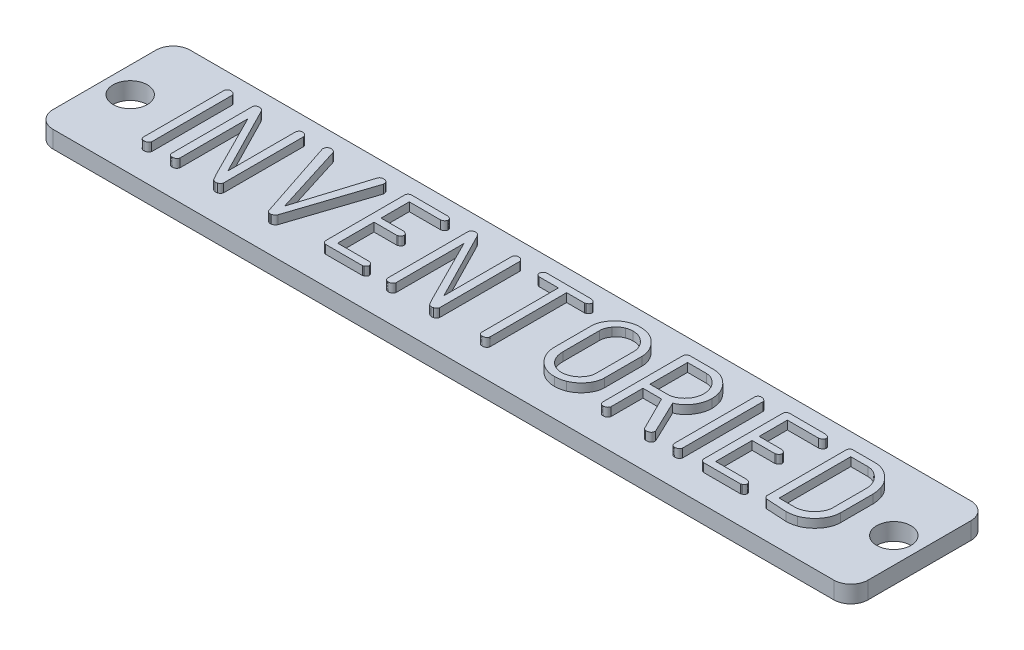
from build123d import *

# Parameters (mm, degrees)
BOSS_EXTRUDE1_DEPTH     = 2
BOSS_EXTRUDE2_DEPTH     = 1
CUT_EXTRUDE1_DEPTH      = 50.328003401
CUT_EXTRUDE1_DEPTH_BACK = 50.328003401
SKETCH1_4_R             = 2


# Read off the part's stored shape, not the designer's step: Boss-Extrude2
with BuildPart() as part:
    # Sketch1 → Boss-Extrude1 (new body)
    with BuildSketch(Plane(origin=(0, 0, 0), x_dir=(1, 0, 0), z_dir=(0, 1, 0))):
        with BuildLine():
            Line((-45.542106678, 13), (45.542106678, 13))
            ThreePointArc((45.542106678, 13), (46.956320241, 12.414213562), (47.542106678, 11))
            Line((47.542106678, 11), (47.542106678, -1))
            ThreePointArc((47.542106678, -1), (46.956320241, -2.414213562), (45.542106678, -3))
            Line((45.542106678, -3), (-45.542106678, -3))
            ThreePointArc((-45.542106678, -3), (-46.956320241, -2.414213562), (-47.542106678, -1))
            Line((-47.542106678, -1), (-47.542106678, 11))
            ThreePointArc((-47.542106678, 11), (-46.956320241, 12.414213562), (-45.542106678, 13))
        make_face()
    extrude(amount=-BOSS_EXTRUDE1_DEPTH)

    # Boss-Extrude2 outline → Boss-Extrude2 (add)
    # profile 1 of 11: a face of its own
    with BuildSketch(Plane(origin=(0, 0, 0), x_dir=(1, 0, 0), z_dir=(0, 1, 0))):
        with BuildLine():
            add(Edge.make_bspline(
                [(-38.161386986, 10.273972603), (-38.102609907, 10.2711418), (-37.989775214, 10.265707491), (-37.830800541, 10.223216376), (-37.69247229, 10.148937164), (-37.619829868, 10.078205715), (-37.583476027, 10.042808219)],
                knots=[0, 0, 0, 0, 0.27475157, 0.527442151, 0.763508807, 1, 1, 1, 1], degree=3))
            add(Edge.make_bspline(
                [(-38.493150685, 9.929366438), (-38.481282362, 9.971800618), (-38.458574036, 10.052992305), (-38.38566006, 10.1564348), (-38.285877994, 10.235772171), (-38.204035231, 10.260885863), (-38.161386986, 10.273972603)],
                knots=[0, 0, 0, 0, 0.259492963, 0.496502381, 0.737627502, 1, 1, 1, 1], degree=3))
            Line((-38.493150685, 9.929366438), (-38.493150685, 0.488013699))
            add(Edge.make_bspline(
                [(-38.075770548, 0.136986301), (-38.130183621, 0.140034548), (-38.23189097, 0.145732242), (-38.366410472, 0.216502274), (-38.459757011, 0.336338436), (-38.481478319, 0.434997394), (-38.493150685, 0.488013699)],
                knots=[0, 0, 0, 0, 0.268759312, 0.502357157, 0.732581963, 1, 1, 1, 1], degree=3))
            add(Edge.make_bspline(
                [(-37.534246575, 0.505136986), (-37.554528221, 0.44933089), (-37.59361884, 0.341770841), (-37.718909388, 0.218629383), (-37.885878051, 0.147877363), (-38.009380125, 0.140794046), (-38.075770548, 0.136986301)],
                knots=[0, 0, 0, 0, 0.24872534, 0.479390456, 0.720138401, 1, 1, 1, 1], degree=3))
            Line((-37.534246575, 0.505136986), (-37.534246575, 9.918664384))
            Line((-37.534246575, 9.918664384), (-37.583476027, 10.042808219))
        make_face()
    # profile 2 of 11: a face of its own
    with BuildSketch(Plane(origin=(0, 0, 0), x_dir=(1, 0, 0), z_dir=(0, 1, 0))):
        with BuildLine():
            add(Edge.make_bspline(
                [(-34.400684932, 10.171232877), (-34.3823995, 10.153804606), (-34.339800633, 10.113202632), (-34.278836533, 10.031580613), (-34.208692647, 9.925201092), (-34.162551193, 9.843377172), (-34.137414384, 9.79880137)],
                knots=[0, 0, 0, 0, 0.165236548, 0.384945242, 0.664932222, 1, 1, 1, 1], degree=3))
            add(Edge.make_bspline(
                [(-34.762414384, 10.273972603), (-34.727341018, 10.272895533), (-34.660181187, 10.270833119), (-34.564313224, 10.250821306), (-34.476898287, 10.219462501), (-34.425879278, 10.187176459), (-34.400684932, 10.171232877)],
                knots=[0, 0, 0, 0, 0.275177783, 0.526921011, 0.766382832, 1, 1, 1, 1], degree=3))
            add(Edge.make_bspline(
                [(-34.905821918, 10.237585616), (-34.891287252, 10.248210886), (-34.849579827, 10.278700243), (-34.796800552, 10.275837624), (-34.762414384, 10.273972603)],
                knots=[0, 0, 0, 0, 0.348491089, 1, 1, 1, 1], degree=3))
            add(Edge.make_bspline(
                [(-35.205479452, 9.914383562), (-35.193582818, 9.959503662), (-35.171657311, 10.042660042), (-35.106581551, 10.147307126), (-35.014121801, 10.215887045), (-34.942514672, 10.230233989), (-34.905821918, 10.237585616)],
                knots=[0, 0, 0, 0, 0.294254159, 0.542310647, 0.76547191, 1, 1, 1, 1], degree=3))
            Line((-35.205479452, 9.914383562), (-35.205479452, 0.488013699))
            add(Edge.make_bspline(
                [(-34.788099315, 0.136986301), (-34.842512389, 0.140034548), (-34.944219737, 0.145732242), (-35.078739239, 0.216502274), (-35.172085778, 0.336338436), (-35.193807086, 0.434997394), (-35.205479452, 0.488013699)],
                knots=[0, 0, 0, 0, 0.268759312, 0.502357157, 0.732581963, 1, 1, 1, 1], degree=3))
            add(Edge.make_bspline(
                [(-34.246575342, 0.505136986), (-34.266856988, 0.44933089), (-34.305947607, 0.341770841), (-34.431238156, 0.218629383), (-34.598206818, 0.147877363), (-34.721708892, 0.140794046), (-34.788099315, 0.136986301)],
                knots=[0, 0, 0, 0, 0.24872534, 0.479390456, 0.720138401, 1, 1, 1, 1], degree=3))
            Line((-34.246575342, 0.505136986), (-34.246575342, 8.435359589))
            Line((-34.246575342, 8.435359589), (-30.520119863, 1.044520548))
            Line((-30.520119863, 1.044520548), (-30.132705479, 0.353167808))
            Line((-30.132705479, 0.353167808), (-30.072773973, 0.265410959))
            add(Edge.make_bspline(
                [(-29.745291096, 0.136986301), (-29.773984311, 0.138808669), (-29.831600646, 0.142468005), (-29.916690999, 0.167098084), (-29.998560272, 0.207943798), (-30.047673968, 0.245974844), (-30.072773973, 0.265410959)],
                knots=[0, 0, 0, 0, 0.239834372, 0.481590406, 0.735062032, 1, 1, 1, 1], degree=3))
            add(Edge.make_bspline(
                [(-29.548373288, 0.171232877), (-29.550022963, 0.165707835), (-29.555511031, 0.147327371), (-29.602357051, 0.145695886), (-29.661585021, 0.136425486), (-29.714032227, 0.136776873), (-29.745291096, 0.136986301)],
                knots=[0, 0, 0, 0, 0.078108728, 0.259848672, 0.558865087, 1, 1, 1, 1], degree=3))
            add(Edge.make_bspline(
                [(-29.178082192, 0.517979452), (-29.191051229, 0.474567522), (-29.216340142, 0.389916635), (-29.300512558, 0.286003577), (-29.413080199, 0.209273568), (-29.501614892, 0.18438005), (-29.548373288, 0.171232877)],
                knots=[0, 0, 0, 0, 0.250944294, 0.489327633, 0.730295328, 1, 1, 1, 1], degree=3))
            Line((-29.178082192, 0.517979452), (-29.178082192, 9.882277397))
            add(Edge.make_bspline(
                [(-29.364297945, 10.17765411), (-29.338671014, 10.149619303), (-29.291632892, 10.098161537), (-29.235648145, 10.019819813), (-29.193454387, 9.950724769), (-29.182812782, 9.903341171), (-29.178082192, 9.882277397)],
                knots=[0, 0, 0, 0, 0.321675196, 0.590433445, 0.817932412, 1, 1, 1, 1], degree=3))
            add(Edge.make_bspline(
                [(-29.73244863, 10.273972603), (-29.69314481, 10.272640905), (-29.619117943, 10.270132715), (-29.517125805, 10.254679401), (-29.431005078, 10.225149796), (-29.385832191, 10.192986559), (-29.364297945, 10.17765411)],
                knots=[0, 0, 0, 0, 0.304096482, 0.572751191, 0.796327371, 1, 1, 1, 1], degree=3))
            add(Edge.make_bspline(
                [(-30.136986301, 9.935787671), (-30.116732965, 9.986332295), (-30.079091474, 10.080271138), (-29.98723481, 10.194905506), (-29.865756821, 10.262080611), (-29.777454674, 10.26995776), (-29.73244863, 10.273972603)],
                knots=[0, 0, 0, 0, 0.287476847, 0.534285164, 0.76263338, 1, 1, 1, 1], degree=3))
            Line((-30.136986301, 9.935787671), (-30.136986301, 1.982020548))
            Line((-30.136986301, 1.982020548), (-34.137414384, 9.79880137))
        make_face()
    # profile 3 of 11: a face of its own
    with BuildSketch(Plane(origin=(0, 0, 0), x_dir=(1, 0, 0), z_dir=(0, 1, 0))):
        with BuildLine():
            add(Edge.make_bspline(
                [(-26.224315068, 10.248287671), (-26.191783343, 10.241044875), (-26.12645103, 10.226499425), (-26.033806204, 10.179544252), (-25.949344866, 10.109305345), (-25.90221718, 10.050184854), (-25.877568493, 10.019263699)],
                knots=[0, 0, 0, 0, 0.233686117, 0.469303557, 0.722435545, 1, 1, 1, 1], degree=3))
            add(Edge.make_bspline(
                [(-26.391267123, 10.273972603), (-26.356802217, 10.271704311), (-26.30033717, 10.267988091), (-26.245630215, 10.253811293), (-26.224315068, 10.248287671)],
                knots=[0, 0, 0, 0, 0.61037594, 1, 1, 1, 1], degree=3))
            add(Edge.make_bspline(
                [(-26.746575342, 10.113441781), (-26.715166222, 10.138060591), (-26.656309626, 10.184193031), (-26.563281021, 10.233118813), (-26.476257472, 10.266598782), (-26.418632936, 10.271598326), (-26.391267123, 10.273972603)],
                knots=[0, 0, 0, 0, 0.301191759, 0.564394074, 0.793131351, 1, 1, 1, 1], degree=3))
            add(Edge.make_bspline(
                [(-26.849315068, 9.73244863), (-26.845934639, 9.803092849), (-26.839488505, 9.937804176), (-26.776521637, 10.056833058), (-26.746575342, 10.113441781)],
                knots=[0, 0, 0, 0, 0.524411873, 1, 1, 1, 1], degree=3))
            Line((-26.849315068, 9.73244863), (-23.741438356, 0.351027397))
            Line((-23.741438356, 0.351027397), (-23.621575342, 0.231164384))
            add(Edge.make_bspline(
                [(-23.356164384, 0.136986301), (-23.408731254, 0.139685655), (-23.506977908, 0.144730705), (-23.585204081, 0.203731816), (-23.621575342, 0.231164384)],
                knots=[0, 0, 0, 0, 0.535049981, 1, 1, 1, 1], degree=3))
            add(Edge.make_bspline(
                [(-23.23630137, 0.143407534), (-23.263414693, 0.142007408), (-23.303373194, 0.13994396), (-23.343322243, 0.13770579), (-23.356164384, 0.136986301)],
                knots=[0, 0, 0, 0, 0.67853703, 1, 1, 1, 1], degree=3))
            add(Edge.make_bspline(
                [(-23.193493151, 0.15625), (-23.199277098, 0.155823407), (-23.214387379, 0.154708954), (-23.227937806, 0.147720767), (-23.23630137, 0.143407534)],
                knots=[0, 0, 0, 0, 0.382782219, 1, 1, 1, 1], degree=3))
            add(Edge.make_bspline(
                [(-22.786815068, 0.492294521), (-22.796671701, 0.459640636), (-22.818068539, 0.38875539), (-22.907833352, 0.299772336), (-23.034034171, 0.219183371), (-23.13684529, 0.178607103), (-23.193493151, 0.15625)],
                knots=[0, 0, 0, 0, 0.183665808, 0.398702824, 0.668691492, 1, 1, 1, 1], degree=3))
            Line((-22.786815068, 0.492294521), (-19.726027397, 9.749571918))
            add(Edge.make_bspline(
                [(-19.781678082, 10.038527397), (-19.764918448, 9.992635919), (-19.73084486, 9.899335117), (-19.72765054, 9.800031484), (-19.726027397, 9.749571918)],
                knots=[0, 0, 0, 0, 0.491865853, 1, 1, 1, 1], degree=3))
            add(Edge.make_bspline(
                [(-20.306078767, 10.273972603), (-20.245152084, 10.271381061), (-20.132905263, 10.266606596), (-19.979314302, 10.225546632), (-19.857619135, 10.148672329), (-19.806679644, 10.074789672), (-19.781678082, 10.038527397)],
                knots=[0, 0, 0, 0, 0.30258632, 0.557462689, 0.782798694, 1, 1, 1, 1], degree=3))
            add(Edge.make_bspline(
                [(-20.695633562, 10.040667808), (-20.670942448, 10.076426298), (-20.623918057, 10.14452858), (-20.528761094, 10.219448439), (-20.42128622, 10.265658021), (-20.34506642, 10.271158844), (-20.306078767, 10.273972603)],
                knots=[0, 0, 0, 0, 0.273150591, 0.520217122, 0.754583347, 1, 1, 1, 1], degree=3))
            Line((-20.695633562, 10.040667808), (-23.279109589, 1.746575342))
            Line((-23.279109589, 1.746575342), (-25.877568493, 10.019263699))
        make_face()
    # profile 4 of 11: a face of its own
    with BuildSketch(Plane(origin=(0, 0, 0), x_dir=(1, 0, 0), z_dir=(0, 1, 0))):
        with BuildLine():
            add(Edge.make_bspline(
                [(-17.397260274, 9.922945205), (-17.384782391, 9.963606955), (-17.361070807, 10.040876033), (-17.298404048, 10.142035151), (-17.208064915, 10.214625013), (-17.136447161, 10.238296483), (-17.099743151, 10.250428082)],
                knots=[0, 0, 0, 0, 0.272676902, 0.518164929, 0.753060126, 1, 1, 1, 1], degree=3))
            Line((-17.397260274, 9.922945205), (-17.397260274, 0.614297945))
            add(Edge.make_bspline(
                [(-17.059075342, 0.273972603), (-17.101465316, 0.286632065), (-17.182759789, 0.310910077), (-17.286503053, 0.3847105), (-17.360829759, 0.489002889), (-17.384715257, 0.571152011), (-17.397260274, 0.614297945)],
                knots=[0, 0, 0, 0, 0.259685621, 0.498018845, 0.73635207, 1, 1, 1, 1], degree=3))
            Line((-17.059075342, 0.273972603), (-12.735445205, 0.273972603))
            Line((-12.735445205, 0.273972603), (-12.585616438, 0.329623288))
            add(Edge.make_bspline(
                [(-12.315924658, 0.678510274), (-12.31993762, 0.650156894), (-12.328689146, 0.588323445), (-12.38334867, 0.498200659), (-12.472276966, 0.411427331), (-12.545534789, 0.358552671), (-12.585616438, 0.329623288)],
                knots=[0, 0, 0, 0, 0.186643541, 0.407034852, 0.675570191, 1, 1, 1, 1], degree=3))
            add(Edge.make_bspline(
                [(-12.360873288, 0.723458904), (-12.352385044, 0.720622202), (-12.330642208, 0.713355923), (-12.321498642, 0.691707383), (-12.315924658, 0.678510274)],
                knots=[0, 0, 0, 0, 0.390392645, 1, 1, 1, 1], degree=3))
            add(Edge.make_bspline(
                [(-12.369434932, 0.815496575), (-12.36694934, 0.798403905), (-12.362508481, 0.767865447), (-12.361373159, 0.737033787), (-12.360873288, 0.723458904)],
                knots=[0, 0, 0, 0, 0.559709661, 1, 1, 1, 1], degree=3))
            add(Edge.make_bspline(
                [(-12.793236301, 1.095890411), (-12.73472566, 1.08144198), (-12.629907435, 1.055558501), (-12.497573146, 0.995039531), (-12.401596415, 0.916869115), (-12.379682076, 0.84779543), (-12.369434932, 0.815496575)],
                knots=[0, 0, 0, 0, 0.336090886, 0.602086212, 0.813935517, 1, 1, 1, 1], degree=3))
            Line((-12.793236301, 1.095890411), (-16.438356164, 1.095890411))
            Line((-16.438356164, 1.095890411), (-16.438356164, 5.342465753))
            Line((-16.438356164, 5.342465753), (-13.773544521, 5.342465753))
            Line((-13.773544521, 5.342465753), (-13.636558219, 5.391695205))
            add(Edge.make_bspline(
                [(-13.345462329, 5.798373288), (-13.348167103, 5.756220808), (-13.353516409, 5.67285469), (-13.415424126, 5.559498877), (-13.509155268, 5.460697715), (-13.592057039, 5.415797419), (-13.636558219, 5.391695205)],
                knots=[0, 0, 0, 0, 0.236932624, 0.468588157, 0.714741263, 1, 1, 1, 1], degree=3))
            add(Edge.make_bspline(
                [(-13.797089041, 6.164383562), (-13.735337724, 6.14876568), (-13.622829577, 6.120310596), (-13.481368688, 6.039946322), (-13.380207202, 5.932095408), (-13.357031092, 5.842897829), (-13.345462329, 5.798373288)],
                knots=[0, 0, 0, 0, 0.307251644, 0.559798792, 0.780265824, 1, 1, 1, 1], degree=3))
            Line((-13.797089041, 6.164383562), (-16.438356164, 6.164383562))
            Line((-16.438356164, 6.164383562), (-16.438356164, 9.452054795))
            Line((-16.438356164, 9.452054795), (-12.782534247, 9.452054795))
            add(Edge.make_bspline(
                [(-12.315924658, 9.850171233), (-12.322458116, 9.821831887), (-12.339639122, 9.747308036), (-12.400912691, 9.659289362), (-12.474395173, 9.579257672), (-12.558962821, 9.526664591), (-12.662517783, 9.4811462), (-12.740728272, 9.462188359), (-12.782534247, 9.452054795)],
                knots=[0, 0, 0, 0, 0.132894215, 0.34947132, 0.481675803, 0.630852073, 0.802678783, 1, 1, 1, 1], degree=3))
            add(Edge.make_bspline(
                [(-12.782534247, 10.261130137), (-12.746022262, 10.25390885), (-12.677196703, 10.240296631), (-12.580546827, 10.211234672), (-12.499828007, 10.170062466), (-12.430940598, 10.124102212), (-12.380947951, 10.066037396), (-12.342916015, 10.001983549), (-12.318377868, 9.928946818), (-12.316752702, 9.876760753), (-12.315924658, 9.850171233)],
                knots=[0, 0, 0, 0, 0.163024703, 0.307303648, 0.440057753, 0.558837742, 0.667306054, 0.77234457, 0.884006416, 1, 1, 1, 1], degree=3))
            Line((-12.782534247, 10.261130137), (-17.05265411, 10.273972603))
            Line((-17.05265411, 10.273972603), (-17.099743151, 10.250428082))
        make_face()
    # profile 5 of 11: a face of its own
    with BuildSketch(Plane(origin=(0, 0, 0), x_dir=(1, 0, 0), z_dir=(0, 1, 0))):
        with BuildLine():
            add(Edge.make_bspline(
                [(-9.195205479, 10.171232877), (-9.176920048, 10.153804606), (-9.134321181, 10.113202632), (-9.073357081, 10.031580613), (-9.003213194, 9.925201092), (-8.957071741, 9.843377172), (-8.931934932, 9.79880137)],
                knots=[0, 0, 0, 0, 0.165236548, 0.384945242, 0.664932222, 1, 1, 1, 1], degree=3))
            add(Edge.make_bspline(
                [(-9.556934932, 10.273972603), (-9.521861566, 10.272895533), (-9.454701735, 10.270833119), (-9.358833772, 10.250821306), (-9.271418835, 10.219462501), (-9.220399826, 10.187176459), (-9.195205479, 10.171232877)],
                knots=[0, 0, 0, 0, 0.275177783, 0.526921011, 0.766382832, 1, 1, 1, 1], degree=3))
            add(Edge.make_bspline(
                [(-9.700342466, 10.237585616), (-9.6858078, 10.248210886), (-9.644100375, 10.278700243), (-9.5913211, 10.275837624), (-9.556934932, 10.273972603)],
                knots=[0, 0, 0, 0, 0.348491089, 1, 1, 1, 1], degree=3))
            add(Edge.make_bspline(
                [(-10, 9.914383562), (-9.988103366, 9.959503662), (-9.966177859, 10.042660042), (-9.901102099, 10.147307126), (-9.808642349, 10.215887045), (-9.73703522, 10.230233989), (-9.700342466, 10.237585616)],
                knots=[0, 0, 0, 0, 0.294254159, 0.542310647, 0.76547191, 1, 1, 1, 1], degree=3))
            Line((-10, 9.914383562), (-10, 0.488013699))
            add(Edge.make_bspline(
                [(-9.582619863, 0.136986301), (-9.637032937, 0.140034548), (-9.738740285, 0.145732242), (-9.873259787, 0.216502274), (-9.966606326, 0.336338436), (-9.988327634, 0.434997394), (-10, 0.488013699)],
                knots=[0, 0, 0, 0, 0.268759312, 0.502357157, 0.732581963, 1, 1, 1, 1], degree=3))
            add(Edge.make_bspline(
                [(-9.04109589, 0.505136986), (-9.061377536, 0.44933089), (-9.100468155, 0.341770841), (-9.225758704, 0.218629383), (-9.392727366, 0.147877363), (-9.51622944, 0.140794046), (-9.582619863, 0.136986301)],
                knots=[0, 0, 0, 0, 0.24872534, 0.479390456, 0.720138401, 1, 1, 1, 1], degree=3))
            Line((-9.04109589, 0.505136986), (-9.04109589, 8.435359589))
            Line((-9.04109589, 8.435359589), (-5.314640411, 1.044520548))
            Line((-5.314640411, 1.044520548), (-4.927226027, 0.353167808))
            Line((-4.927226027, 0.353167808), (-4.867294521, 0.265410959))
            add(Edge.make_bspline(
                [(-4.539811644, 0.136986301), (-4.568504859, 0.138808669), (-4.626121194, 0.142468005), (-4.711211547, 0.167098084), (-4.79308082, 0.207943798), (-4.842194516, 0.245974844), (-4.867294521, 0.265410959)],
                knots=[0, 0, 0, 0, 0.239834372, 0.481590406, 0.735062032, 1, 1, 1, 1], degree=3))
            add(Edge.make_bspline(
                [(-4.342893836, 0.171232877), (-4.344543511, 0.165707835), (-4.350031579, 0.147327371), (-4.396877599, 0.145695886), (-4.456105569, 0.136425486), (-4.508552775, 0.136776873), (-4.539811644, 0.136986301)],
                knots=[0, 0, 0, 0, 0.078108728, 0.259848672, 0.558865087, 1, 1, 1, 1], degree=3))
            add(Edge.make_bspline(
                [(-3.97260274, 0.517979452), (-3.985571777, 0.474567522), (-4.01086069, 0.389916635), (-4.095033106, 0.286003577), (-4.207600747, 0.209273568), (-4.29613544, 0.18438005), (-4.342893836, 0.171232877)],
                knots=[0, 0, 0, 0, 0.250944294, 0.489327633, 0.730295328, 1, 1, 1, 1], degree=3))
            Line((-3.97260274, 0.517979452), (-3.97260274, 9.882277397))
            add(Edge.make_bspline(
                [(-4.158818493, 10.17765411), (-4.133191562, 10.149619303), (-4.08615344, 10.098161537), (-4.030168693, 10.019819813), (-3.987974935, 9.950724769), (-3.97733333, 9.903341171), (-3.97260274, 9.882277397)],
                knots=[0, 0, 0, 0, 0.321675196, 0.590433445, 0.817932412, 1, 1, 1, 1], degree=3))
            add(Edge.make_bspline(
                [(-4.526969178, 10.273972603), (-4.487665358, 10.272640905), (-4.413638491, 10.270132715), (-4.311646353, 10.254679401), (-4.225525626, 10.225149796), (-4.180352739, 10.192986559), (-4.158818493, 10.17765411)],
                knots=[0, 0, 0, 0, 0.304096482, 0.572751191, 0.796327371, 1, 1, 1, 1], degree=3))
            add(Edge.make_bspline(
                [(-4.931506849, 9.935787671), (-4.911253513, 9.986332295), (-4.873612022, 10.080271138), (-4.781755358, 10.194905506), (-4.660277369, 10.262080611), (-4.571975222, 10.26995776), (-4.526969178, 10.273972603)],
                knots=[0, 0, 0, 0, 0.287476847, 0.534285164, 0.76263338, 1, 1, 1, 1], degree=3))
            Line((-4.931506849, 9.935787671), (-4.931506849, 1.982020548))
            Line((-4.931506849, 1.982020548), (-8.931934932, 9.79880137))
        make_face()
    # profile 6 of 11: a face of its own
    with BuildSketch(Plane(origin=(0, 0, 0), x_dir=(1, 0, 0), z_dir=(0, 1, 0))):
        with BuildLine():
            add(Edge.make_bspline(
                [(-1.42765411, 10.220462329), (-1.405515047, 10.228251095), (-1.356119646, 10.245628942), (-1.307045064, 10.263893974), (-1.279965753, 10.273972603)],
                knots=[0, 0, 0, 0, 0.448200883, 1, 1, 1, 1], degree=3))
            add(Edge.make_bspline(
                [(-1.643835616, 9.758133562), (-1.641821033, 9.806978313), (-1.637977208, 9.900174087), (-1.596534828, 10.030040923), (-1.526260461, 10.139991155), (-1.46069715, 10.193496396), (-1.42765411, 10.220462329)],
                knots=[0, 0, 0, 0, 0.274997332, 0.524694837, 0.760452496, 1, 1, 1, 1], degree=3))
            add(Edge.make_bspline(
                [(-1.282106164, 9.452054795), (-1.32434329, 9.462688927), (-1.405948578, 9.483234867), (-1.512326776, 9.550110354), (-1.59520855, 9.643108883), (-1.627341543, 9.719117728), (-1.643835616, 9.758133562)],
                knots=[0, 0, 0, 0, 0.261379594, 0.505004944, 0.745915827, 1, 1, 1, 1], degree=3))
            Line((-1.282106164, 9.452054795), (0.95890411, 9.452054795))
            Line((0.95890411, 9.452054795), (0.95890411, 0.488013699))
            add(Edge.make_bspline(
                [(1.369863014, 0.136986301), (1.315279653, 0.13971783), (1.21452144, 0.144760098), (1.083066286, 0.218042125), (0.989746921, 0.33588636), (0.96967249, 0.43490035), (0.95890411, 0.488013699)],
                knots=[0, 0, 0, 0, 0.270723937, 0.499743136, 0.731650881, 1, 1, 1, 1], degree=3))
            add(Edge.make_bspline(
                [(1.917808219, 0.522260274), (1.911695752, 0.492030779), (1.899876122, 0.433576241), (1.865822724, 0.35242093), (1.815314028, 0.28566734), (1.752890272, 0.228950863), (1.675450766, 0.187619908), (1.58519213, 0.15679616), (1.481715731, 0.140876576), (1.408436074, 0.138327885), (1.369863014, 0.136986301)],
                knots=[0, 0, 0, 0, 0.124465859, 0.240678661, 0.351959507, 0.460173341, 0.578897804, 0.703796937, 0.844084166, 1, 1, 1, 1], degree=3))
            Line((1.917808219, 0.522260274), (1.917808219, 9.452054795))
            Line((1.917808219, 9.452054795), (4.013270548, 9.452054795))
            Line((4.013270548, 9.452054795), (4.143835616, 9.497003425))
            add(Edge.make_bspline(
                [(4.462756849, 9.903681507), (4.459335891, 9.862869325), (4.452458533, 9.780822156), (4.384520338, 9.66829059), (4.2805155, 9.57057204), (4.19165244, 9.522741064), (4.143835616, 9.497003425)],
                knots=[0, 0, 0, 0, 0.222516328, 0.447337873, 0.702614928, 1, 1, 1, 1], degree=3))
            add(Edge.make_bspline(
                [(3.99614726, 10.261130137), (4.056986234, 10.245881945), (4.169405271, 10.217706139), (4.313526058, 10.141272413), (4.418318661, 10.035326683), (4.447967477, 9.947494039), (4.462756849, 9.903681507)],
                knots=[0, 0, 0, 0, 0.301790485, 0.557652335, 0.779348881, 1, 1, 1, 1], degree=3))
            Line((3.99614726, 10.261130137), (-1.279965753, 10.273972603))
        make_face()
    # profile 7 of 11: a face of its own
    with BuildSketch(Plane(origin=(0, 0, 0), x_dir=(1, 0, 0), z_dir=(0, 1, 0))):
        with BuildLine():
            add(Edge.make_bspline(
                [(11.716609589, 9.514126712), (11.797923745, 9.435579818), (11.956472837, 9.282426425), (12.165681355, 9.034807226), (12.340624736, 8.779150558), (12.49016066, 8.519099088), (12.60051087, 8.248534843), (12.680164005, 7.971562364), (12.732321047, 7.688181674), (12.737250421, 7.495944915), (12.739726027, 7.399400685)],
                knots=[0, 0, 0, 0, 0.140061782, 0.273097201, 0.40088926, 0.523625025, 0.644159001, 0.761979947, 0.880462701, 1, 1, 1, 1], degree=3))
            add(Edge.make_bspline(
                [(9.651113014, 10.273972603), (9.752507363, 10.271192685), (9.951594358, 10.26573434), (10.244158323, 10.2320435), (10.52338097, 10.171505128), (10.789621575, 10.088644828), (11.042258987, 9.980089858), (11.282176722, 9.849929827), (11.509186897, 9.695248166), (11.647132534, 9.574794063), (11.716609589, 9.514126712)],
                knots=[0, 0, 0, 0, 0.134933536, 0.264940918, 0.391191814, 0.514601435, 0.6353979, 0.756477576, 0.877348635, 1, 1, 1, 1], degree=3))
            add(Edge.make_bspline(
                [(8.540239726, 10.055650685), (8.629511826, 10.089710349), (8.807465609, 10.157604419), (9.084892559, 10.224350536), (9.366511386, 10.267183325), (9.556063853, 10.27170517), (9.651113014, 10.273972603)],
                knots=[0, 0, 0, 0, 0.251394257, 0.501125872, 0.749844632, 1, 1, 1, 1], degree=3))
            add(Edge.make_bspline(
                [(6.712328767, 7.497859589), (6.714134098, 7.564988713), (6.717717325, 7.698226811), (6.741645447, 7.896679311), (6.782583927, 8.092110834), (6.840058487, 8.284966053), (6.916484556, 8.47380981), (7.005495257, 8.660762964), (7.114141496, 8.842759813), (7.275420733, 9.081048068), (7.504250081, 9.357132408), (7.818737492, 9.641884802), (8.161608428, 9.882736625), (8.414044923, 9.998019803), (8.540239726, 10.055650685)],
                knots=[0, 0, 0, 0, 0.060601714, 0.120282475, 0.180161033, 0.240683965, 0.301684861, 0.363911284, 0.427431067, 0.492817583, 0.623615994, 0.749916976, 0.874981714, 1, 1, 1, 1], degree=3))
            Line((6.712328767, 7.497859589), (6.712328767, 3.328339041))
            add(Edge.make_bspline(
                [(7.703339041, 1.031678082), (7.623803043, 1.10850298), (7.467183356, 1.259784058), (7.26552822, 1.512571763), (7.095033583, 1.779663618), (6.955921605, 2.061244107), (6.844525706, 2.356894269), (6.769457947, 2.668271926), (6.719828683, 2.993555784), (6.714858386, 3.215421219), (6.712328767, 3.328339041)],
                knots=[0, 0, 0, 0, 0.128561489, 0.253159082, 0.37521953, 0.496626056, 0.617987158, 0.742019252, 0.868701386, 1, 1, 1, 1], degree=3))
            add(Edge.make_bspline(
                [(9.678938356, 0.273972603), (9.583952455, 0.276718296), (9.397641644, 0.282103857), (9.12294594, 0.316368451), (8.859245097, 0.376433365), (8.606076687, 0.460794665), (8.361890336, 0.565054671), (8.130545138, 0.697283545), (7.908228815, 0.851079448), (7.772127498, 0.971044987), (7.703339041, 1.031678082)],
                knots=[0, 0, 0, 0, 0.131444636, 0.257823069, 0.38236792, 0.505067676, 0.626670185, 0.74913138, 0.873205746, 1, 1, 1, 1], degree=3))
            add(Edge.make_bspline(
                [(10.839041096, 0.49015411), (10.749744824, 0.456842787), (10.568921664, 0.389388027), (10.283690799, 0.322932109), (9.985604208, 0.280338558), (9.782545855, 0.27612335), (9.678938356, 0.273972603)],
                knots=[0, 0, 0, 0, 0.240608794, 0.487227982, 0.738365719, 1, 1, 1, 1], degree=3))
            add(Edge.make_bspline(
                [(12.739726027, 3.050085616), (12.733733746, 2.922425257), (12.721671564, 2.66545093), (12.615933062, 2.285724106), (12.452519589, 1.912109927), (12.222609372, 1.554133471), (11.943355924, 1.220204129), (11.616293048, 0.926452435), (11.248376683, 0.676033242), (10.976671884, 0.552652197), (10.839041096, 0.49015411)],
                knots=[0, 0, 0, 0, 0.113452148, 0.228373862, 0.348384749, 0.475424725, 0.60569876, 0.734765808, 0.865646869, 1, 1, 1, 1], degree=3))
            Line((12.739726027, 3.050085616), (12.739726027, 7.399400685))
        make_face()
        with BuildLine():
            add(Edge.make_bspline(
                [(11.780821918, 7.474315068), (11.777178823, 7.545211018), (11.769664707, 7.691438445), (11.716818849, 7.914402222), (11.633017618, 8.147218522), (11.554368774, 8.299916201), (11.513270548, 8.379708904)],
                knots=[0, 0, 0, 0, 0.223016892, 0.459986593, 0.717814119, 1, 1, 1, 1], degree=3))
            Line((11.780821918, 7.474315068), (11.780821918, 3.017979452))
            add(Edge.make_bspline(
                [(10.445205479, 1.239297945), (10.535752732, 1.278026228), (10.716515225, 1.355340788), (10.964435125, 1.51970613), (11.191063942, 1.719152215), (11.393904446, 1.94949762), (11.563781263, 2.201320673), (11.688027637, 2.466769321), (11.768238371, 2.739339789), (11.776641423, 2.925410028), (11.780821918, 3.017979452)],
                knots=[0, 0, 0, 0, 0.125379626, 0.250299518, 0.377319107, 0.509474921, 0.640697204, 0.763218267, 0.882201749, 1, 1, 1, 1], degree=3))
            add(Edge.make_bspline(
                [(9.678938356, 1.095890411), (9.743260165, 1.097359801), (9.872507239, 1.100312367), (10.06504765, 1.129998007), (10.257181992, 1.174279606), (10.382044805, 1.217457045), (10.445205479, 1.239297945)],
                knots=[0, 0, 0, 0, 0.246095694, 0.494500214, 0.744297708, 1, 1, 1, 1], degree=3))
            add(Edge.make_bspline(
                [(8.418236301, 1.556078767), (8.463300091, 1.519598167), (8.5528397, 1.447112948), (8.696346602, 1.353656301), (8.845323089, 1.272507642), (9.001830622, 1.209766672), (9.162422012, 1.157372894), (9.329403552, 1.120834558), (9.502122432, 1.09909554), (9.619657287, 1.096964994), (9.678938356, 1.095890411)],
                knots=[0, 0, 0, 0, 0.126729323, 0.251805143, 0.373975833, 0.497129106, 0.620005273, 0.743049757, 0.870401974, 1, 1, 1, 1], degree=3))
            add(Edge.make_bspline(
                [(7.671232877, 3.300513699), (7.672747576, 3.211174835), (7.675705761, 3.036697445), (7.714621713, 2.78255622), (7.770727962, 2.54174833), (7.853152541, 2.31501992), (7.957933476, 2.102030294), (8.087514772, 1.90394449), (8.240425083, 1.719807585), (8.358420964, 1.611156813), (8.418236301, 1.556078767)],
                knots=[0, 0, 0, 0, 0.136556167, 0.266692039, 0.392450928, 0.514341456, 0.634919896, 0.754814547, 0.875708792, 1, 1, 1, 1], degree=3))
            Line((7.671232877, 3.300513699), (7.671232877, 7.529965753))
            add(Edge.make_bspline(
                [(8.037243151, 8.600171233), (7.980685173, 8.519155427), (7.869665139, 8.360126092), (7.75699571, 8.093697634), (7.684684744, 7.816346421), (7.675744925, 7.626024055), (7.671232877, 7.529965753)],
                knots=[0, 0, 0, 0, 0.256974761, 0.504426575, 0.749877314, 1, 1, 1, 1], degree=3))
            add(Edge.make_bspline(
                [(8.919092466, 9.306506849), (8.839746436, 9.272215311), (8.67691876, 9.201844914), (8.454824306, 9.037316294), (8.232900322, 8.842081468), (8.104194857, 8.682950223), (8.037243151, 8.600171233)],
                knots=[0, 0, 0, 0, 0.226109314, 0.464003737, 0.721178394, 1, 1, 1, 1], degree=3))
            add(Edge.make_bspline(
                [(9.64255137, 9.452054795), (9.585353995, 9.450524064), (9.468165807, 9.447387844), (9.290084314, 9.416908755), (9.10485075, 9.373131019), (8.982220261, 9.329148299), (8.919092466, 9.306506849)],
                knots=[0, 0, 0, 0, 0.231129394, 0.473546817, 0.728992123, 1, 1, 1, 1], degree=3))
            add(Edge.make_bspline(
                [(11.095890411, 8.872003425), (11.049199388, 8.918917204), (10.956449793, 9.012109295), (10.798931593, 9.128677569), (10.632620703, 9.228434829), (10.455458151, 9.31035853), (10.267564383, 9.37452864), (10.068005003, 9.419026308), (9.858868961, 9.447894972), (9.715423449, 9.450653453), (9.64255137, 9.452054795)],
                knots=[0, 0, 0, 0, 0.123145854, 0.244623644, 0.36383364, 0.483951479, 0.607519766, 0.732939711, 0.8643301, 1, 1, 1, 1], degree=3))
            add(Edge.make_bspline(
                [(11.513270548, 8.379708904), (11.487706854, 8.42305906), (11.435233561, 8.512041716), (11.33862541, 8.637940746), (11.223632779, 8.758032162), (11.139232724, 8.833333576), (11.095890411, 8.872003425)],
                knots=[0, 0, 0, 0, 0.232497074, 0.4772349, 0.731542257, 1, 1, 1, 1], degree=3))
        make_face(mode=Mode.SUBTRACT)
    # profile 8 of 11: a face of its own
    with BuildSketch(Plane(origin=(0, 0, 0), x_dir=(1, 0, 0), z_dir=(0, 1, 0))):
        with BuildLine():
            add(Edge.make_bspline(
                [(15.068493151, 9.927226027), (15.080278423, 9.973098112), (15.102102413, 10.058044127), (15.168381813, 10.16358573), (15.262675984, 10.23182773), (15.334996905, 10.242673636), (15.372431507, 10.248287671)],
                knots=[0, 0, 0, 0, 0.295583453, 0.547362002, 0.765706484, 1, 1, 1, 1], degree=3))
            Line((15.068493151, 9.927226027), (15.068493151, 0.488013699))
            add(Edge.make_bspline(
                [(15.485873288, 0.136986301), (15.431460214, 0.140034548), (15.329752866, 0.145732242), (15.195233364, 0.216502274), (15.101886824, 0.336338436), (15.080165517, 0.434997394), (15.068493151, 0.488013699)],
                knots=[0, 0, 0, 0, 0.268759312, 0.502357157, 0.732581963, 1, 1, 1, 1], degree=3))
            add(Edge.make_bspline(
                [(16.02739726, 0.505136986), (16.007115614, 0.44933089), (15.968024995, 0.341770841), (15.842734447, 0.218629383), (15.675765784, 0.147877363), (15.552263711, 0.140794046), (15.485873288, 0.136986301)],
                knots=[0, 0, 0, 0, 0.24872534, 0.479390456, 0.720138401, 1, 1, 1, 1], degree=3))
            Line((16.02739726, 0.505136986), (16.02739726, 4.246575342))
            Line((16.02739726, 4.246575342), (18.199914384, 4.246575342))
            Line((18.199914384, 4.246575342), (20.141267123, 0.353167808))
            add(Edge.make_bspline(
                [(20.415239726, 0.136986301), (20.385365887, 0.14552685), (20.326986464, 0.16221678), (20.250897961, 0.211617336), (20.186439803, 0.2746114), (20.156528046, 0.326628686), (20.141267123, 0.353167808)],
                knots=[0, 0, 0, 0, 0.257275694, 0.502767868, 0.746313092, 1, 1, 1, 1], degree=3))
            add(Edge.make_bspline(
                [(21.095890411, 0.650684932), (21.09415273, 0.614907382), (21.090810216, 0.546087544), (21.067639448, 0.446430431), (21.023367249, 0.358671917), (20.964821641, 0.277063835), (20.875997106, 0.208788794), (20.751208069, 0.167665594), (20.594878591, 0.139767427), (20.478913438, 0.137972082), (20.415239726, 0.136986301)],
                knots=[0, 0, 0, 0, 0.109431073, 0.210495938, 0.310018462, 0.408192772, 0.515537998, 0.646018257, 0.805637028, 1, 1, 1, 1], degree=3))
            Line((21.095890411, 0.650684932), (19.26181401, 4.489648109))
            add(Edge.make_bspline(
                [(21.095890411, 7.262414384), (21.094332795, 7.185987962), (21.091237801, 7.034128149), (21.063707046, 6.809014099), (21.024487042, 6.586631964), (20.963315514, 6.369720096), (20.888902192, 6.154985571), (20.792887671, 5.94601303), (20.685336918, 5.737994768), (20.558859403, 5.538920502), (20.422823352, 5.349209909), (20.278746436, 5.172836709), (20.122547711, 5.017854013), (19.96537943, 4.873001804), (19.794613171, 4.753271117), (19.620969264, 4.644048587), (19.44309471, 4.555562783), (19.320721059, 4.510875667), (19.26181401, 4.489648109)],
                knots=[0, 0, 0, 0, 0.064627493, 0.128415264, 0.191632223, 0.255474227, 0.318852335, 0.383690869, 0.449836595, 0.516822395, 0.582987395, 0.647284282, 0.709170453, 0.76901867, 0.827816783, 0.885270528, 0.942495551, 0.995435439, 0.995435439, 0.995435439, 0.995435439], degree=3))
            add(Edge.make_bspline(
                [(20.931078767, 8.232020548), (20.956597003, 8.145300975), (21.005982812, 7.977471339), (21.057144223, 7.728430174), (21.088759996, 7.491541905), (21.0935563, 7.33741829), (21.095890411, 7.262414384)],
                knots=[0, 0, 0, 0, 0.274660112, 0.531553661, 0.772031653, 1, 1, 1, 1], degree=3))
            add(Edge.make_bspline(
                [(18.247003425, 10.273972603), (18.322677673, 10.271461453), (18.473093053, 10.266470117), (18.696718042, 10.240342267), (18.913966322, 10.185633395), (19.128307944, 10.120208235), (19.334576124, 10.026390374), (19.539904837, 9.921846108), (19.735429459, 9.788454672), (19.927084912, 9.642910129), (20.106274915, 9.483005185), (20.274131156, 9.31919401), (20.423810344, 9.148761576), (20.560891141, 8.976583567), (20.674416037, 8.794758947), (20.779659416, 8.613094726), (20.865162586, 8.425073355), (20.909267093, 8.295901751), (20.931078767, 8.232020548)],
                knots=[0, 0, 0, 0, 0.063334505, 0.125888051, 0.187846544, 0.250511034, 0.313050342, 0.377122946, 0.443004626, 0.510689134, 0.57834469, 0.643759735, 0.706755882, 0.76800024, 0.827599798, 0.885860481, 0.943552843, 1, 1, 1, 1], degree=3))
            Line((18.247003425, 10.273972603), (15.40239726, 10.273972603))
            Line((15.40239726, 10.273972603), (15.372431507, 10.248287671))
        make_face()
        with BuildLine():
            add(Edge.make_bspline(
                [(19.987157534, 8.065068493), (19.950787772, 8.157792867), (19.878194702, 8.342868227), (19.716400468, 8.597635426), (19.521433233, 8.835006454), (19.290353791, 9.044067579), (19.043685284, 9.223211892), (18.785106322, 9.355020216), (18.520892537, 9.436663977), (18.341719312, 9.446974084), (18.253424658, 9.452054795)],
                knots=[0, 0, 0, 0, 0.126921602, 0.253332109, 0.383392996, 0.518155027, 0.650113326, 0.771527021, 0.887410953, 1, 1, 1, 1], degree=3))
            add(Edge.make_bspline(
                [(20.136986301, 7.281678082), (20.135435539, 7.34527663), (20.132284684, 7.47449686), (20.102914627, 7.669364981), (20.056106942, 7.867916614), (20.010485231, 7.998365974), (19.987157534, 8.065068493)],
                knots=[0, 0, 0, 0, 0.237834602, 0.483234966, 0.735763138, 1, 1, 1, 1], degree=3))
            add(Edge.make_bspline(
                [(19.619006849, 5.824058219), (19.660717236, 5.873914138), (19.743468489, 5.972825708), (19.848616945, 6.134583527), (19.93572847, 6.305475526), (20.012657002, 6.482368876), (20.067167387, 6.671139347), (20.108127364, 6.867104641), (20.131695079, 7.072063218), (20.135201873, 7.210986909), (20.136986301, 7.281678082)],
                knots=[0, 0, 0, 0, 0.123176323, 0.244375466, 0.364786807, 0.486648574, 0.609490128, 0.736578943, 0.865958473, 1, 1, 1, 1], degree=3))
            add(Edge.make_bspline(
                [(18.247003425, 5.068493151), (18.311443455, 5.077232176), (18.439372739, 5.094581286), (18.627274041, 5.142778125), (18.809170059, 5.20840676), (18.984332416, 5.295743299), (19.153080642, 5.40084322), (19.316831962, 5.523464848), (19.47331628, 5.665065439), (19.569888756, 5.770455421), (19.619006849, 5.824058219)],
                knots=[0, 0, 0, 0, 0.121463731, 0.24113533, 0.361791105, 0.482262498, 0.60623329, 0.732921398, 0.86416014, 1, 1, 1, 1], degree=3))
            Line((18.247003425, 5.068493151), (16.02739726, 5.068493151))
            Line((16.02739726, 5.068493151), (16.02739726, 9.452054795))
            Line((16.02739726, 9.452054795), (18.253424658, 9.452054795))
        make_face(mode=Mode.SUBTRACT)
    # profile 9 of 11: a face of its own
    with BuildSketch(Plane(origin=(0, 0, 0), x_dir=(1, 0, 0), z_dir=(0, 1, 0))):
        with BuildLine():
            add(Edge.make_bspline(
                [(23.756421233, 10.273972603), (23.815198312, 10.2711418), (23.928033005, 10.265707491), (24.087007678, 10.223216376), (24.225335929, 10.148937164), (24.297978351, 10.078205715), (24.334332192, 10.042808219)],
                knots=[0, 0, 0, 0, 0.27475157, 0.527442151, 0.763508807, 1, 1, 1, 1], degree=3))
            add(Edge.make_bspline(
                [(23.424657534, 9.929366438), (23.436525857, 9.971800618), (23.459234183, 10.052992305), (23.53214816, 10.1564348), (23.631930226, 10.235772171), (23.713772988, 10.260885863), (23.756421233, 10.273972603)],
                knots=[0, 0, 0, 0, 0.259492963, 0.496502381, 0.737627502, 1, 1, 1, 1], degree=3))
            Line((23.424657534, 9.929366438), (23.424657534, 0.488013699))
            add(Edge.make_bspline(
                [(23.842037671, 0.136986301), (23.787624598, 0.140034548), (23.68591725, 0.145732242), (23.551397748, 0.216502274), (23.458051208, 0.336338436), (23.4363299, 0.434997394), (23.424657534, 0.488013699)],
                knots=[0, 0, 0, 0, 0.268759312, 0.502357157, 0.732581963, 1, 1, 1, 1], degree=3))
            add(Edge.make_bspline(
                [(24.383561644, 0.505136986), (24.363279998, 0.44933089), (24.324189379, 0.341770841), (24.198898831, 0.218629383), (24.031930168, 0.147877363), (23.908428094, 0.140794046), (23.842037671, 0.136986301)],
                knots=[0, 0, 0, 0, 0.24872534, 0.479390456, 0.720138401, 1, 1, 1, 1], degree=3))
            Line((24.383561644, 0.505136986), (24.383561644, 9.918664384))
            Line((24.383561644, 9.918664384), (24.334332192, 10.042808219))
        make_face()
    # profile 10 of 11: a face of its own
    with BuildSketch(Plane(origin=(0, 0, 0), x_dir=(1, 0, 0), z_dir=(0, 1, 0))):
        with BuildLine():
            add(Edge.make_bspline(
                [(26.712328767, 9.922945205), (26.72480665, 9.963606955), (26.748518235, 10.040876033), (26.811184993, 10.142035151), (26.901524126, 10.214625013), (26.97314188, 10.238296483), (27.00984589, 10.250428082)],
                knots=[0, 0, 0, 0, 0.272676902, 0.518164929, 0.753060126, 1, 1, 1, 1], degree=3))
            Line((26.712328767, 9.922945205), (26.712328767, 0.614297945))
            add(Edge.make_bspline(
                [(27.050513699, 0.273972603), (27.008123725, 0.286632065), (26.926829252, 0.310910077), (26.823085988, 0.3847105), (26.748759282, 0.489002889), (26.724873784, 0.571152011), (26.712328767, 0.614297945)],
                knots=[0, 0, 0, 0, 0.259685621, 0.498018845, 0.73635207, 1, 1, 1, 1], degree=3))
            Line((27.050513699, 0.273972603), (31.374143836, 0.273972603))
            Line((31.374143836, 0.273972603), (31.523972603, 0.329623288))
            add(Edge.make_bspline(
                [(31.793664384, 0.678510274), (31.789651421, 0.650156894), (31.780899895, 0.588323445), (31.726240371, 0.498200659), (31.637312075, 0.411427331), (31.564054252, 0.358552671), (31.523972603, 0.329623288)],
                knots=[0, 0, 0, 0, 0.186643541, 0.407034852, 0.675570191, 1, 1, 1, 1], degree=3))
            add(Edge.make_bspline(
                [(31.748715753, 0.723458904), (31.757203997, 0.720622202), (31.778946833, 0.713355923), (31.788090399, 0.691707383), (31.793664384, 0.678510274)],
                knots=[0, 0, 0, 0, 0.390392645, 1, 1, 1, 1], degree=3))
            add(Edge.make_bspline(
                [(31.74015411, 0.815496575), (31.742639701, 0.798403905), (31.74708056, 0.767865447), (31.748215882, 0.737033787), (31.748715753, 0.723458904)],
                knots=[0, 0, 0, 0, 0.559709661, 1, 1, 1, 1], degree=3))
            add(Edge.make_bspline(
                [(31.31635274, 1.095890411), (31.374863381, 1.08144198), (31.479681607, 1.055558501), (31.612015895, 0.995039531), (31.707992626, 0.916869115), (31.729906965, 0.84779543), (31.74015411, 0.815496575)],
                knots=[0, 0, 0, 0, 0.336090886, 0.602086212, 0.813935517, 1, 1, 1, 1], degree=3))
            Line((31.31635274, 1.095890411), (27.671232877, 1.095890411))
            Line((27.671232877, 1.095890411), (27.671232877, 5.342465753))
            Line((27.671232877, 5.342465753), (30.336044521, 5.342465753))
            Line((30.336044521, 5.342465753), (30.473030822, 5.391695205))
            add(Edge.make_bspline(
                [(30.764126712, 5.798373288), (30.761421938, 5.756220808), (30.756072632, 5.67285469), (30.694164915, 5.559498877), (30.600433773, 5.460697715), (30.517532003, 5.415797419), (30.473030822, 5.391695205)],
                knots=[0, 0, 0, 0, 0.236932624, 0.468588157, 0.714741263, 1, 1, 1, 1], degree=3))
            add(Edge.make_bspline(
                [(30.3125, 6.164383562), (30.374251318, 6.14876568), (30.486759464, 6.120310596), (30.628220353, 6.039946322), (30.729381839, 5.932095408), (30.752557949, 5.842897829), (30.764126712, 5.798373288)],
                knots=[0, 0, 0, 0, 0.307251644, 0.559798792, 0.780265824, 1, 1, 1, 1], degree=3))
            Line((30.3125, 6.164383562), (27.671232877, 6.164383562))
            Line((27.671232877, 6.164383562), (27.671232877, 9.452054795))
            Line((27.671232877, 9.452054795), (31.327054795, 9.452054795))
            add(Edge.make_bspline(
                [(31.793664384, 9.850171233), (31.787130925, 9.821831887), (31.769949919, 9.747308036), (31.70867635, 9.659289362), (31.635193868, 9.579257672), (31.55062622, 9.526664591), (31.447071258, 9.4811462), (31.368860769, 9.462188359), (31.327054795, 9.452054795)],
                knots=[0, 0, 0, 0, 0.132894215, 0.34947132, 0.481675803, 0.630852073, 0.802678783, 1, 1, 1, 1], degree=3))
            add(Edge.make_bspline(
                [(31.327054795, 10.261130137), (31.36356678, 10.25390885), (31.432392338, 10.240296631), (31.529042214, 10.211234672), (31.609761034, 10.170062466), (31.678648443, 10.124102212), (31.72864109, 10.066037396), (31.766673026, 10.001983549), (31.791211173, 9.928946818), (31.792836339, 9.876760753), (31.793664384, 9.850171233)],
                knots=[0, 0, 0, 0, 0.163024703, 0.307303648, 0.440057753, 0.558837742, 0.667306054, 0.77234457, 0.884006416, 1, 1, 1, 1], degree=3))
            Line((31.327054795, 10.261130137), (27.056934932, 10.273972603))
            Line((27.056934932, 10.273972603), (27.00984589, 10.250428082))
        make_face()
    # profile 11 of 11: a face of its own
    with BuildSketch(Plane(origin=(0, 0, 0), x_dir=(1, 0, 0), z_dir=(0, 1, 0))):
        with BuildLine():
            add(Edge.make_bspline(
                [(34.109589041, 9.931506849), (34.121392668, 9.977377541), (34.143003385, 10.061360076), (34.208668085, 10.167073572), (34.303375153, 10.236401147), (34.377486378, 10.247071318), (34.415667808, 10.252568493)],
                knots=[0, 0, 0, 0, 0.29429036, 0.538802645, 0.762395311, 1, 1, 1, 1], degree=3))
            Line((34.109589041, 9.931506849), (34.109589041, 0.614297945))
            add(Edge.make_bspline(
                [(34.430650685, 0.273972603), (34.390143447, 0.286417654), (34.31191891, 0.310450602), (34.216289976, 0.388715459), (34.144130278, 0.490619831), (34.121445209, 0.571845831), (34.109589041, 0.614297945)],
                knots=[0, 0, 0, 0, 0.254774586, 0.492001556, 0.734498712, 1, 1, 1, 1], degree=3))
            Line((34.430650685, 0.273972603), (36.812928082, 0.136986301))
            add(Edge.make_bspline(
                [(37.985873288, 0.340325342), (37.890825261, 0.30833304), (37.701656742, 0.244660633), (37.408377564, 0.185356086), (37.112338823, 0.144057665), (36.91295999, 0.139348815), (36.812928082, 0.136986301)],
                knots=[0, 0, 0, 0, 0.251310319, 0.500168209, 0.749225497, 1, 1, 1, 1], degree=3))
            add(Edge.make_bspline(
                [(40.136986301, 3.199914384), (40.13551674, 3.127047263), (40.132581147, 2.981488058), (40.103184695, 2.763821333), (40.056926214, 2.548047837), (39.989088524, 2.335316658), (39.905956371, 2.12440917), (39.801758127, 1.916018225), (39.680456428, 1.708689611), (39.539573841, 1.506646002), (39.383908777, 1.313965954), (39.219630703, 1.130141231), (39.041360849, 0.963414908), (38.851978923, 0.811073608), (38.652168436, 0.670887241), (38.440796727, 0.545710837), (38.219187163, 0.432139051), (38.064207384, 0.371151387), (37.985873288, 0.340325342)],
                knots=[0, 0, 0, 0, 0.057565868, 0.114993455, 0.173286731, 0.231789671, 0.291271074, 0.352304151, 0.415751538, 0.480985759, 0.546775816, 0.611454342, 0.675686336, 0.739451218, 0.803437658, 0.868430112, 0.933498367, 1, 1, 1, 1], degree=3))
            Line((40.136986301, 3.199914384), (40.136986301, 6.98630137))
            add(Edge.make_bspline(
                [(39.940068493, 8.095034247), (39.969943772, 7.996937976), (40.027920253, 7.806570668), (40.090501099, 7.522742181), (40.128432312, 7.250603996), (40.13418873, 7.072741195), (40.136986301, 6.98630137)],
                knots=[0, 0, 0, 0, 0.272065076, 0.527974165, 0.770599416, 1, 1, 1, 1], degree=3))
            add(Edge.make_bspline(
                [(37.054794521, 10.273972603), (37.134817299, 10.271952726), (37.294789606, 10.267914821), (37.531687161, 10.234172617), (37.76407883, 10.183647226), (37.991380429, 10.109911251), (38.212879346, 10.013320852), (38.429946922, 9.89657848), (38.643855615, 9.761815931), (38.847160798, 9.603703619), (39.04306642, 9.436756942), (39.223558077, 9.261075136), (39.385211842, 9.079039373), (39.533425024, 8.89418654), (39.660777765, 8.702477467), (39.770740434, 8.505310186), (39.866623752, 8.304353293), (39.915612384, 8.164734669), (39.940068493, 8.095034247)],
                knots=[0, 0, 0, 0, 0.062479735, 0.124902279, 0.186558873, 0.248066686, 0.311218851, 0.375046093, 0.440442786, 0.508435635, 0.576016125, 0.64143656, 0.704980947, 0.766080925, 0.826362106, 0.884497842, 0.942339002, 1, 1, 1, 1], degree=3))
            Line((37.054794521, 10.273972603), (34.452054795, 10.273972603))
            Line((34.452054795, 10.273972603), (34.415667808, 10.252568493))
        make_face()
        with BuildLine():
            add(Edge.make_bspline(
                [(39.068921233, 7.825342466), (39.033468023, 7.932586191), (38.962197267, 8.148175736), (38.784345078, 8.444999566), (38.56189811, 8.722555729), (38.292721693, 8.968703784), (38.001216797, 9.181491245), (37.692140109, 9.336677987), (37.376101181, 9.434822767), (37.161053346, 9.446356017), (37.054794521, 9.452054795)],
                knots=[0, 0, 0, 0, 0.122706444, 0.246673886, 0.374359074, 0.509087383, 0.642796431, 0.766180275, 0.884465662, 1, 1, 1, 1], degree=3))
            add(Edge.make_bspline(
                [(39.178082192, 7.215325342), (39.176895188, 7.258932218), (39.174391574, 7.350907256), (39.150098267, 7.49582387), (39.116500383, 7.655970627), (39.08530935, 7.767004191), (39.068921233, 7.825342466)],
                knots=[0, 0, 0, 0, 0.210306436, 0.443575517, 0.707648358, 1, 1, 1, 1], degree=3))
            Line((39.178082192, 7.215325342), (39.178082192, 3.274828767))
            add(Edge.make_bspline(
                [(37.602739726, 1.22859589), (37.709156757, 1.268800405), (37.922106291, 1.349253058), (38.216212886, 1.531175958), (38.48307718, 1.761460234), (38.720881864, 2.03060921), (38.924442806, 2.323697015), (39.067809205, 2.635619023), (39.163103923, 2.95245664), (39.173112491, 3.167867601), (39.178082192, 3.274828767)],
                knots=[0, 0, 0, 0, 0.12425817, 0.248651171, 0.376015003, 0.508736494, 0.640829586, 0.764829946, 0.883227561, 1, 1, 1, 1], degree=3))
            add(Edge.make_bspline(
                [(36.928510274, 1.095890411), (36.977133593, 1.097674805), (37.079973961, 1.101448874), (37.241301656, 1.130288716), (37.41842553, 1.169390773), (37.539521119, 1.208288908), (37.602739726, 1.22859589)],
                knots=[0, 0, 0, 0, 0.211398253, 0.447116212, 0.711364027, 1, 1, 1, 1], degree=3))
            Line((36.928510274, 1.095890411), (35.068493151, 1.095890411))
            Line((35.068493151, 1.095890411), (35.068493151, 9.452054795))
            Line((35.068493151, 9.452054795), (37.054794521, 9.452054795))
        make_face(mode=Mode.SUBTRACT)
    extrude(amount=BOSS_EXTRUDE2_DEPTH)

    # Sketch1<4> → Cut-Extrude1 (cut, two sides: drawn at the far end of the back side and taken through both)
    with BuildSketch(Plane(origin=(0, 0, 0), x_dir=(1, 0, 0), z_dir=(0, 1, 0)).offset(-CUT_EXTRUDE1_DEPTH_BACK)):
        with Locations(Location((-44.542106678, 5, 0), (0, 0, 270))):
            Circle(SKETCH1_4_R)
        with Locations(Location((44.542106678, 5, 0), (0, 0, 270))):
            Circle(SKETCH1_4_R)
    extrude(amount=CUT_EXTRUDE1_DEPTH + CUT_EXTRUDE1_DEPTH_BACK, mode=Mode.SUBTRACT)


solid = part.part
